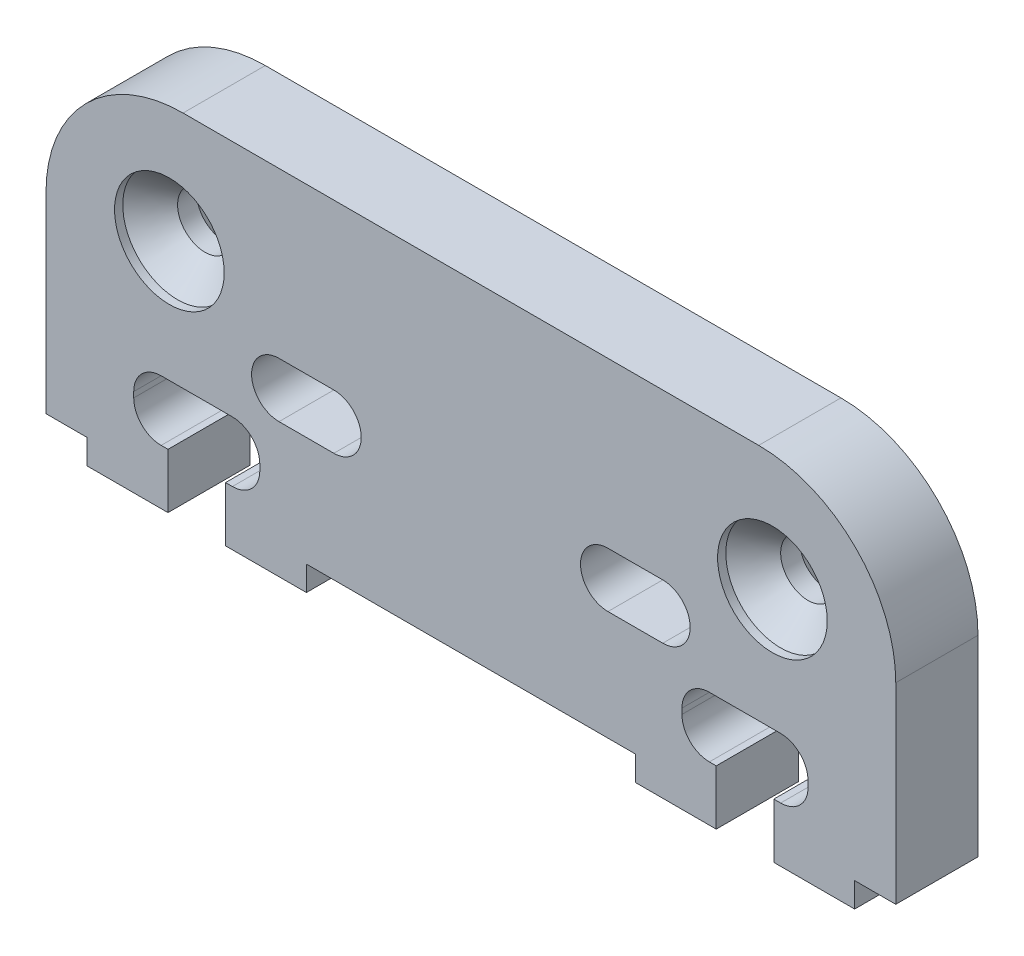
from build123d import *

# Parameters (mm, degrees)
BASE_SHAPE_DEPTH                               = 3
EDGE_RADIUSES_R                                = 5
CAMERA_MOUNT_POCKETS_DEPTH                     = 1
CAMERA_MOUNT_HOLES_REACH                       = 19.084
SKETCH3_R                                      = 1
CSK_FOR_M2_FLAT_HEAD_MACHINE_SCREW1_AT_2_COUNT = 2
CSK_FOR_M2_FLAT_HEAD_MACHINE_SCREW1_AT_2_PITCH = 22
F_1MM_MILLING_RADIUSES_R                       = 1


with BuildPart() as part:
    # Sketch1 → Base shape (new body)
    with BuildSketch(Plane.XY):
        Polygon((15.5, 6), (-15.5, 6), (-15.5, -6), (-14, -6), (-14, -6.9), (-11.05, -6.9), (-11.05, -4.9), (-12.3, -4.9), (-12.3, -2.7), (-7.7, -2.7), (-7.7, -4.9), (-8.95, -4.9), (-8.95, -6.9), (-6, -6.9), (-6, -6), (6, -6), (6, -6.9), (8.95, -6.9), (8.95, -4.9), (7.7, -4.9), (7.7, -2.7), (12.3, -2.7), (12.3, -4.9), (11.05, -4.9), (11.05, -6.9), (14, -6.9), (14, -6), (15.5, -6), align=None)
        with BuildLine():
            Line((-5, -2), (-7, -2))
            ThreePointArc((-7, -2), (-8, -1), (-7, 0))
            Line((-7, 0), (-5, 0))
            ThreePointArc((-5, 0), (-4, -1), (-5, -2))
        make_face(mode=Mode.SUBTRACT)
        with BuildLine():
            ThreePointArc((7, 0), (8, -1), (7, -2))
            Line((7, -2), (5, -2))
            ThreePointArc((5, -2), (4, -1), (5, 0))
            Line((5, 0), (7, 0))
        make_face(mode=Mode.SUBTRACT)
    extrude(amount=BASE_SHAPE_DEPTH)

    # Edge radiuses
    edge_radiuses_edges = [part.edges().sort_by_distance(p)[0] for p in [
        (15.5, 6, 1.5),
        (-15.5, 6, 1.5),
    ]]
    fillet(edge_radiuses_edges, radius=EDGE_RADIUSES_R)

    # Sketch2 → Camera mount pockets (cut)
    with BuildSketch(Plane(origin=(0, 0, 0), x_dir=(-1, 0, 0), z_dir=(0, 0, -1))):
        with BuildLine():
            Line((-11.1, 5.1), (-10.9, 5.1))
            ThreePointArc((-10.9, 5.1), (-10.192893219, 4.807106781), (-9.9, 4.1))
            Line((-9.9, 4.1), (-9.9, -0.7))
            ThreePointArc((-9.9, -0.7), (-10.192893219, -1.407106781), (-10.9, -1.7))
            Line((-10.9, -1.7), (-11.1, -1.7))
            ThreePointArc((-11.1, -1.7), (-11.807106781, -1.407106781), (-12.1, -0.7))
            Line((-12.1, -0.7), (-12.1, 4.1))
            ThreePointArc((-12.1, 4.1), (-11.807106781, 4.807106781), (-11.1, 5.1))
        make_face()
        with BuildLine():
            Line((11.1, 5.1), (10.9, 5.1))
            ThreePointArc((10.9, 5.1), (10.192893219, 4.807106781), (9.9, 4.1))
            Line((9.9, 4.1), (9.9, -0.7))
            ThreePointArc((9.9, -0.7), (10.192893219, -1.407106781), (10.9, -1.7))
            Line((10.9, -1.7), (11.1, -1.7))
            ThreePointArc((11.1, -1.7), (11.807106781, -1.407106781), (12.1, -0.7))
            Line((12.1, -0.7), (12.1, 4.1))
            ThreePointArc((12.1, 4.1), (11.807106781, 4.807106781), (11.1, 5.1))
        make_face()
    extrude(amount=-CAMERA_MOUNT_POCKETS_DEPTH, mode=Mode.SUBTRACT)

    # Sketch3 → Camera mount holes (cut, up to next)
    with BuildSketch(Plane(origin=(0, 0, 1), x_dir=(-1, 0, 0), z_dir=(0, 0, -1)), mode=Mode.PRIVATE) as camera_mount_holes_sk1:
        with Locations((-11, 1.7)):
            Circle(SKETCH3_R)
    camera_mount_holes_tool1 = extrude(camera_mount_holes_sk1.sketch, amount=-CAMERA_MOUNT_HOLES_REACH, mode=Mode.PRIVATE) & part.part
    # Sketch3 → Camera mount holes (cut, up to next)
    with BuildSketch(Plane(origin=(0, 0, 1), x_dir=(-1, 0, 0), z_dir=(0, 0, -1)), mode=Mode.PRIVATE) as camera_mount_holes_sk2:
        with Locations((11, 1.7)):
            Circle(SKETCH3_R)
    camera_mount_holes_tool2 = extrude(camera_mount_holes_sk2.sketch, amount=-CAMERA_MOUNT_HOLES_REACH, mode=Mode.PRIVATE) & part.part
    add(camera_mount_holes_tool1.solids().sort_by_distance((11, 1.7, 1))[0], mode=Mode.SUBTRACT)
    add(camera_mount_holes_tool2.solids().sort_by_distance((-11, 1.7, 1))[0], mode=Mode.SUBTRACT)

    # Sketch5 → CSK for M2 Flat Head Machine Screw1 (revolve, cut)
    with BuildSketch(Plane(origin=(-11, 1.7, 3), x_dir=(0, -1, 0), z_dir=(1, 0, 0))):
        Polygon((0, 0), (0, 3), (1, 3), (1, 1.3), (2, 0.3), (2, 0), align=None)
    csk_for_m2_flat_head_machine_screw1 = revolve(axis=Axis((-11, 1.7, 9.35), (0, 0, -1)), mode=Mode.SUBTRACT)

    # CSK for M2 Flat Head Machine Screw1 at 2: CSK for M2 Flat Head Machine Screw1 ×2
    with Locations(*[(i * CSK_FOR_M2_FLAT_HEAD_MACHINE_SCREW1_AT_2_PITCH, 0, 0) for i in range(1, CSK_FOR_M2_FLAT_HEAD_MACHINE_SCREW1_AT_2_COUNT)]):
        add(csk_for_m2_flat_head_machine_screw1, mode=Mode.SUBTRACT)

    # 1mm milling radiuses
    f_1mm_milling_radiuses_edges = [part.edges().sort_by_distance(p)[0] for p in [
        (-7.7, -2.7, 1.5),
        (-7.7, -4.9, 1.5),
        (12.3, -4.9, 1.5),
        (12.3, -2.7, 1.5),
        (7.7, -2.7, 1.5),
        (7.7, -4.9, 1.5),
        (-12.3, -4.9, 1.5),
        (-12.3, -2.7, 1.5),
    ]]
    fillet(f_1mm_milling_radiuses_edges, radius=F_1MM_MILLING_RADIUSES_R)


solid = part.part
